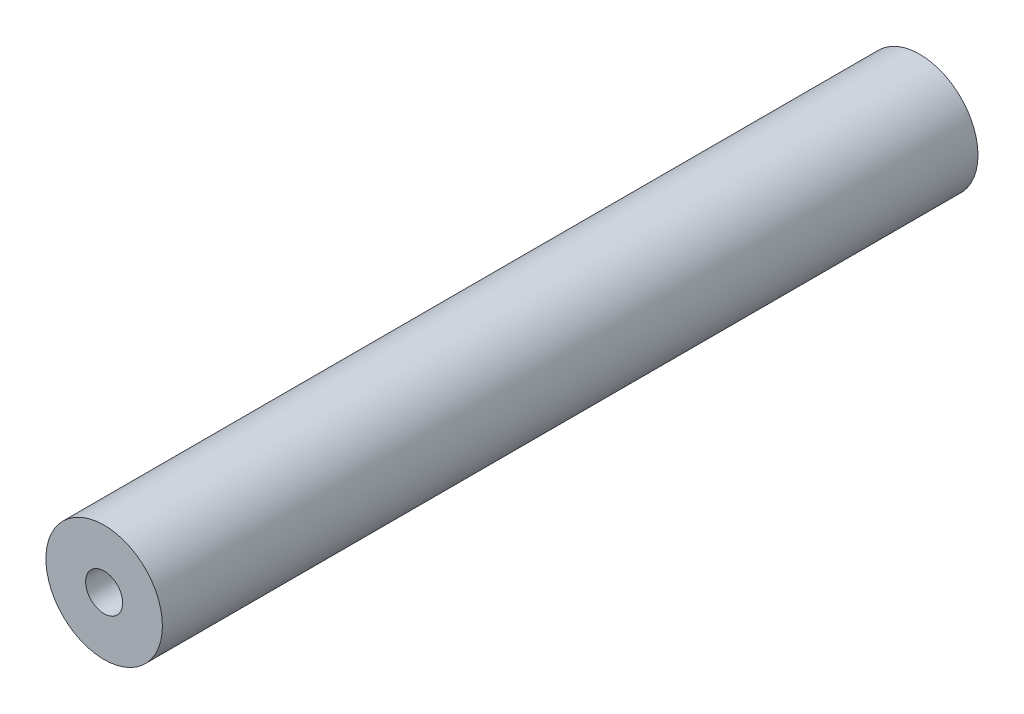
from build123d import *

# Parameters (mm, degrees)
SKETCH1_R           = 6.35
SKETCH1_R_2         = 2.0193
BOSS_EXTRUDE1_DEPTH = 44.45


with BuildPart() as part:
    # Sketch1 → Boss-Extrude1 (new, symmetric)
    with BuildSketch(Plane.XY):
        Circle(SKETCH1_R)
        Circle(SKETCH1_R_2, mode=Mode.SUBTRACT)
    extrude(amount=BOSS_EXTRUDE1_DEPTH, both=True)


solid = part.part
